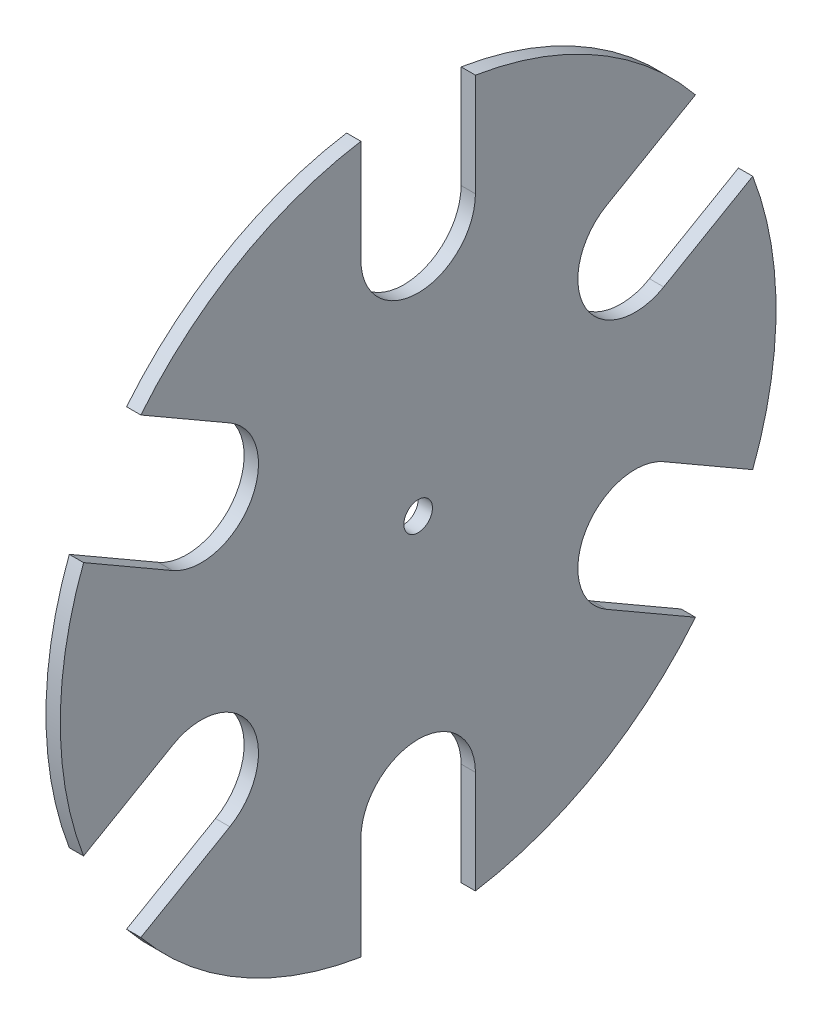
from build123d import *

# Parameters (mm, degrees)
SKETCH1_R               = 250
SKETCH1_R_2             = 10
SKETCH1_R_3             = 40
BOSS_EXTRUDE1_DEPTH     = 10
CUT_EXTRUDE1_DEPTH      = 354.694783677
CUT_EXTRUDE1_DEPTH_BACK = 354.694783677


with BuildPart() as part:
    # Sketch1 → Boss-Extrude1 (new body)
    with BuildSketch(Plane(origin=(0, 0, 0), x_dir=(0, 0, -1), z_dir=(1, 0, 0))):
        Circle(SKETCH1_R)
        Circle(SKETCH1_R_2, mode=Mode.SUBTRACT)
        with Locations((0, 175)):
            Circle(SKETCH1_R_3, mode=Mode.SUBTRACT)
        with Locations((151.554445662, 87.5)):
            Circle(SKETCH1_R_3, mode=Mode.SUBTRACT)
        with Locations((151.554445662, -87.5)):
            Circle(SKETCH1_R_3, mode=Mode.SUBTRACT)
        with Locations((0, -175)):
            Circle(SKETCH1_R_3, mode=Mode.SUBTRACT)
        with Locations((-151.554445662, -87.5)):
            Circle(SKETCH1_R_3, mode=Mode.SUBTRACT)
        with Locations((-151.554445662, 87.5)):
            Circle(SKETCH1_R_3, mode=Mode.SUBTRACT)
    extrude(amount=BOSS_EXTRUDE1_DEPTH)

    # Sketch2 → Cut-Extrude1 (cut, two sides: drawn at the far end of the back side and taken through both)
    with BuildSketch(Plane.ZY.offset(-CUT_EXTRUDE1_DEPTH_BACK)):
        with BuildLine():
            Line((-40, 175), (-40, 246.779253585))
            ThreePointArc((-40, 246.779253585), (0, 250), (40, 246.779253585))
            Line((40, 246.779253585), (40, 175))
            ThreePointArc((40, 175), (0, 215), (-40, 175))
        make_face()
        with BuildLine():
            Line((131.554445662, 122.141016151), (193.717102732, 158.030642944))
            ThreePointArc((193.717102732, 158.030642944), (216.506350946, 125), (233.717102732, 88.748610641))
            Line((233.717102732, 88.748610641), (171.554445662, 52.858983849))
            ThreePointArc((171.554445662, 52.858983849), (186.195461814, 107.5), (131.554445662, 122.141016151))
        make_face()
        with BuildLine():
            Line((171.554445662, -52.858983849), (233.717102732, -88.748610641))
            ThreePointArc((233.717102732, -88.748610641), (216.506350946, -125), (193.717102732, -158.030642944))
            Line((193.717102732, -158.030642944), (131.554445662, -122.141016151))
            ThreePointArc((131.554445662, -122.141016151), (186.195461814, -107.5), (171.554445662, -52.858983849))
        make_face()
        with BuildLine():
            Line((40, -175), (40, -246.779253585))
            ThreePointArc((40, -246.779253585), (0, -250), (-40, -246.779253585))
            Line((-40, -246.779253585), (-40, -175))
            ThreePointArc((-40, -175), (0, -215), (40, -175))
        make_face()
        with BuildLine():
            Line((-131.554445662, -122.141016151), (-193.717102732, -158.030642944))
            ThreePointArc((-193.717102732, -158.030642944), (-216.506350946, -125), (-233.717102732, -88.748610641))
            Line((-233.717102732, -88.748610641), (-171.554445662, -52.858983849))
            ThreePointArc((-171.554445662, -52.858983849), (-186.195461814, -107.5), (-131.554445662, -122.141016151))
        make_face()
        with BuildLine():
            Line((-171.554445662, 52.858983849), (-233.717102732, 88.748610641))
            ThreePointArc((-233.717102732, 88.748610641), (-216.506350946, 125), (-193.717102732, 158.030642944))
            Line((-193.717102732, 158.030642944), (-131.554445662, 122.141016151))
            ThreePointArc((-131.554445662, 122.141016151), (-186.195461814, 107.5), (-171.554445662, 52.858983849))
        make_face()
    extrude(amount=CUT_EXTRUDE1_DEPTH + CUT_EXTRUDE1_DEPTH_BACK, mode=Mode.SUBTRACT)


solid = part.part
